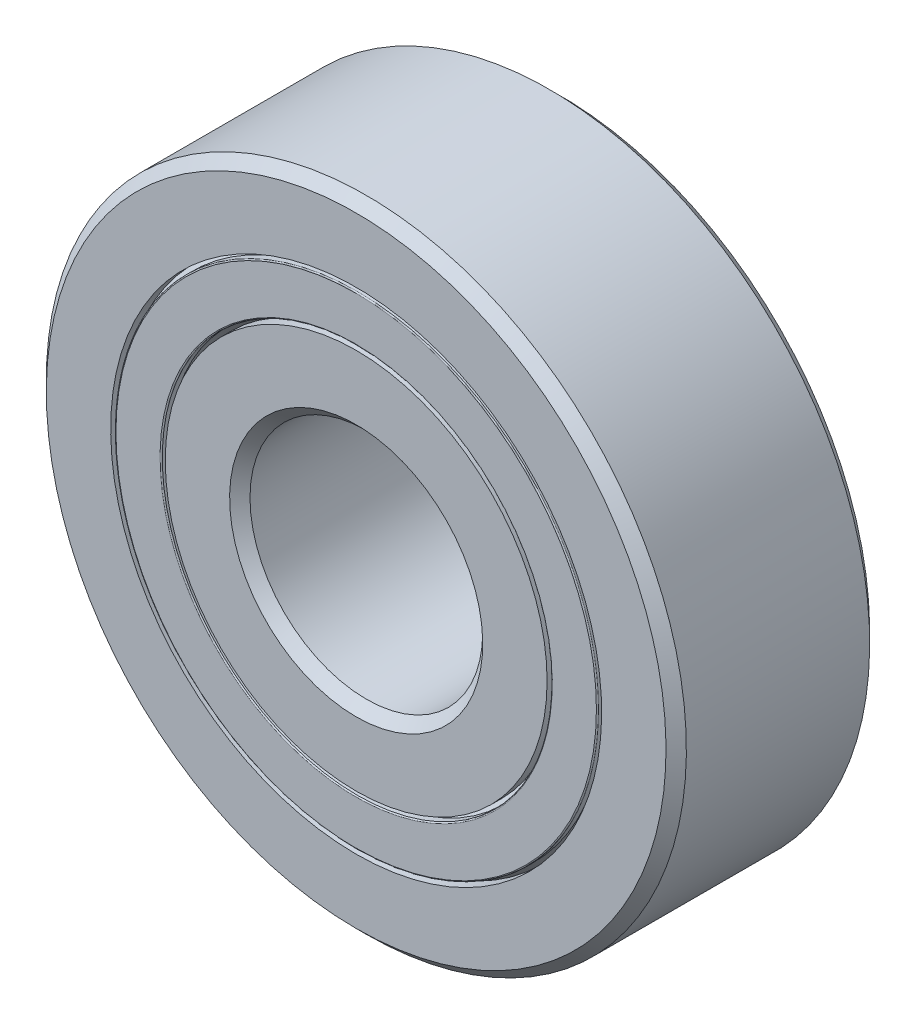
from build123d import *

# Parameters (mm, degrees)
CIRPATTERN1_COUNT   = 7
SKETCH7_R           = 7.96875
SKETCH7_R_2         = 7.5
BOSS_EXTRUDE1_DEPTH = 0.583333333
FILLET1_R           = 0.038888889
FILLET2_R           = 0.038888889


with BuildPart() as part:
    # Sketch3 → Revolve1 (revolve)
    with BuildSketch(Plane(origin=(0, 0, 0), x_dir=(0, 0, -1), z_dir=(1, 0, 0))):
        with BuildLine():
            Line((3.15, 11), (3.5, 10.65))
            Line((3.5, 10.65), (3.5, 8.4375))
            Line((3.5, 8.4375), (1.555555556, 8.4375))
            ThreePointArc((1.555555556, 8.4375), (0, 9.316221169), (-1.555555556, 8.4375))
            Line((-1.555555556, 8.4375), (-3.5, 8.4375))
            Line((-3.5, 8.4375), (-3.5, 10.65))
            Line((-3.5, 10.65), (-3.15, 11))
            Line((-3.15, 11), (3.15, 11))
        make_face()
    revolve(axis=Axis((0, 0, 3.5), (0, 0, -1)))


with BuildPart() as body_2:
    # Sketch4 → Revolve2 (revolve)
    with BuildSketch(Plane(origin=(0, 0, 0), x_dir=(0, 0, -1), z_dir=(1, 0, 0))):
        with BuildLine():
            Line((-3.15, 4), (-3.5, 4.35))
            Line((-3.5, 4.35), (-3.5, 6.5625))
            Line((-3.5, 6.5625), (-1.555555556, 6.5625))
            ThreePointArc((-1.555555556, 6.5625), (0, 5.683778831), (1.555555556, 6.5625))
            Line((1.555555556, 6.5625), (3.5, 6.5625))
            Line((3.5, 6.5625), (3.5, 4.35))
            Line((3.5, 4.35), (3.15, 4))
            Line((3.15, 4), (-3.15, 4))
        make_face()
    revolve(axis=Axis((0, 0, 3.5), (0, 0, -1)))


with BuildPart() as body_3:
    # Sketch5 → Revolve3 (revolve)
    with BuildSketch(Plane(origin=(0, 0, 0), x_dir=(0, 0, -1), z_dir=(1, 0, 0))):
        with BuildLine():
            Line((-1.816221169, 7.5), (1.816221169, 7.5))
            ThreePointArc((1.816221169, 7.5), (0, 9.316221169), (-1.816221169, 7.5))
        make_face()
    revolve(axis=Axis((0, 7.5, 1.816221169), (0, 0, -1)))


with BuildPart() as body_4:
    # Sketch6 → Revolve4 (revolve)
    with BuildSketch(Plane(origin=(0, 0, 0), x_dir=(0, 0, -1), z_dir=(1, 0, 0))):
        with BuildLine():
            Line((-1.754688797, 7.96875), (-2.045573997, 7.96875))
            ThreePointArc((-2.045573997, 7.96875), (-2.191016598, 7.5), (-2.045573997, 7.03125))
            Line((-2.045573997, 7.03125), (-1.754688797, 7.03125))
            ThreePointArc((-1.754688797, 7.03125), (-1.816221169, 7.5), (-1.754688797, 7.96875))
        make_face()
    revolve(axis=Axis((0, 11, 0), (0, -1, 0)))


with BuildPart() as cirpattern1_1:
    # CirPattern1: pattern copy
    add(body_4.part.rotate(Axis((0, 0, 3.5), (0, 0, -1)), 1 * 360 / CIRPATTERN1_COUNT))


with BuildPart() as cirpattern1_2:
    # CirPattern1: pattern copy
    add(body_4.part.rotate(Axis((0, 0, 3.5), (0, 0, -1)), 2 * 360 / CIRPATTERN1_COUNT))


with BuildPart() as cirpattern1_3:
    # CirPattern1: pattern copy
    add(body_4.part.rotate(Axis((0, 0, 3.5), (0, 0, -1)), 3 * 360 / CIRPATTERN1_COUNT))


with BuildPart() as cirpattern1_4:
    # CirPattern1: pattern copy
    add(body_4.part.rotate(Axis((0, 0, 3.5), (0, 0, -1)), 4 * 360 / CIRPATTERN1_COUNT))


with BuildPart() as cirpattern1_5:
    # CirPattern1: pattern copy
    add(body_4.part.rotate(Axis((0, 0, 3.5), (0, 0, -1)), 5 * 360 / CIRPATTERN1_COUNT))


with BuildPart() as cirpattern1_6:
    # CirPattern1: pattern copy
    add(body_4.part.rotate(Axis((0, 0, 3.5), (0, 0, -1)), 6 * 360 / CIRPATTERN1_COUNT))


with BuildPart() as cirpattern1_7:
    # CirPattern1: pattern copy
    add(body_3.part.rotate(Axis((0, 0, 3.5), (0, 0, -1)), 1 * 360 / CIRPATTERN1_COUNT))


with BuildPart() as cirpattern1_8:
    # CirPattern1: pattern copy
    add(body_3.part.rotate(Axis((0, 0, 3.5), (0, 0, -1)), 2 * 360 / CIRPATTERN1_COUNT))


with BuildPart() as cirpattern1_9:
    # CirPattern1: pattern copy
    add(body_3.part.rotate(Axis((0, 0, 3.5), (0, 0, -1)), 3 * 360 / CIRPATTERN1_COUNT))


with BuildPart() as cirpattern1_10:
    # CirPattern1: pattern copy
    add(body_3.part.rotate(Axis((0, 0, 3.5), (0, 0, -1)), 4 * 360 / CIRPATTERN1_COUNT))


with BuildPart() as cirpattern1_11:
    # CirPattern1: pattern copy
    add(body_3.part.rotate(Axis((0, 0, 3.5), (0, 0, -1)), 5 * 360 / CIRPATTERN1_COUNT))


with BuildPart() as cirpattern1_12:
    # CirPattern1: pattern copy
    add(body_3.part.rotate(Axis((0, 0, 3.5), (0, 0, -1)), 6 * 360 / CIRPATTERN1_COUNT))


with BuildPart() as body_17:
    # Sketch7 → Boss-Extrude1 (new, symmetric)
    with BuildSketch(Plane.XY):
        Circle(SKETCH7_R)
        Circle(SKETCH7_R_2, mode=Mode.SUBTRACT)
    extrude(amount=BOSS_EXTRUDE1_DEPTH, both=True)


with BuildPart() as body_18:
    # Sketch8 → Revolve5 (revolve)
    with BuildSketch(Plane(origin=(0, 0, 0), x_dir=(0, 0, -1), z_dir=(1, 0, 0))):
        Polygon((-3.5, 8.296875), (-3.240740741, 8.296875), (-3.111111111, 8.4375), (-3.111111111, 8.296875), (-3.111111111, 6.703125), (-3.111111111, 6.5625), (-3.240740741, 6.703125), (-3.5, 6.703125), align=None)
        Polygon((3.5, 8.296875), (3.5, 6.703125), (3.240740741, 6.703125), (3.111111111, 6.5625), (3.111111111, 6.703125), (3.111111111, 8.296875), (3.111111111, 8.4375), (3.240740741, 8.296875), align=None)
    revolve(axis=Axis((0, 0, 3.5), (0, 0, -1)))

    # Fillet1
    fillet1_edges = [body_18.edges().sort_by_distance(p)[0] for p in [
        (0, -8.296875, 3.5),
        (0, -6.703125, 3.5),
    ]]
    fillet(fillet1_edges, radius=FILLET1_R)

    # Fillet2
    fillet2_edges = [body_18.edges().sort_by_distance(p)[0] for p in [
        (0, -6.703125, -3.5),
        (0, -8.296875, -3.5),
    ]]
    fillet(fillet2_edges, radius=FILLET2_R)


solid = Compound([part.part, body_2.part, body_3.part, body_4.part, cirpattern1_1.part, cirpattern1_2.part, cirpattern1_3.part, cirpattern1_4.part, cirpattern1_5.part, cirpattern1_6.part, cirpattern1_7.part, cirpattern1_8.part, cirpattern1_9.part, cirpattern1_10.part, cirpattern1_11.part, cirpattern1_12.part, body_17.part, body_18.part])
